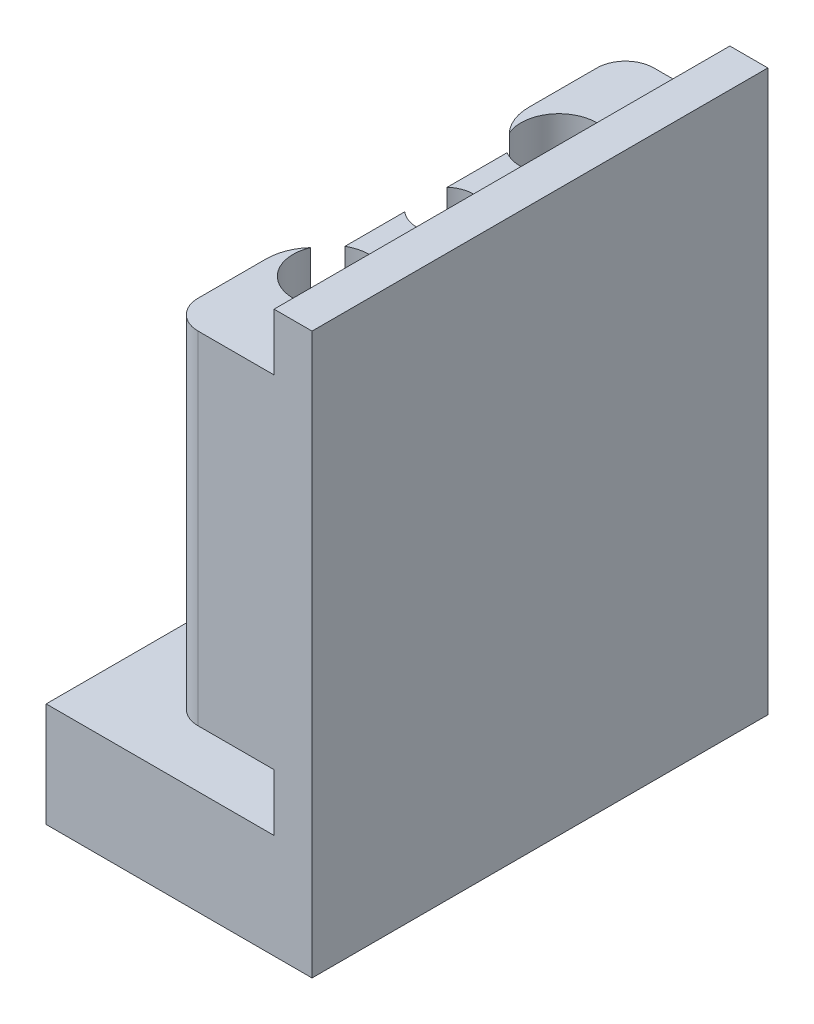
from build123d import *

# Parameters (mm, degrees)
SKETCH1_W           = 12
SKETCH1_H           = 24
BOSS_EXTRUDE1_DEPTH = 5.5
SKETCH2_W           = 2
SKETCH2_H           = 24
BOSS_EXTRUDE2_DEPTH = 29.5
BOSS_EXTRUDE4_START = 3
SKETCH4_W           = 5.5
SKETCH4_H           = 24
BOSS_EXTRUDE4_DEPTH = 18
SKETCH5_W           = 9.25
SKETCH5_H           = 18
CUT_EXTRUDE1_DEPTH  = 1.5
FILLET1_R           = 2.5
SKETCH6_R           = 2
SKETCH6_R_2         = 1.5
CUT_EXTRUDE2_DEPTH  = 31.170349683
FILLET2_R           = 1.5


with BuildPart() as part:
    # Sketch1 → Boss-Extrude1 (new body)
    with BuildSketch(Plane(origin=(0, 0, 0), x_dir=(1, 0, 0), z_dir=(0, 1, 0))):
        Rectangle(SKETCH1_W, SKETCH1_H)
    extrude(amount=BOSS_EXTRUDE1_DEPTH)

    # Sketch2 → Boss-Extrude2 (add)
    with BuildSketch(Plane(origin=(0, 0, 0), x_dir=(1, 0, 0), z_dir=(0, 1, 0))):
        with Locations((7, 0)):
            Rectangle(SKETCH2_W, SKETCH2_H)
    extrude(amount=BOSS_EXTRUDE2_DEPTH)

    # Sketch4 → Boss-Extrude4 (add)
    with BuildSketch(Plane(origin=(0, 5.5, 0), x_dir=(1, 0, 0), z_dir=(0, 1, 0)).offset(BOSS_EXTRUDE4_START)):
        with Locations((3.25, 0)):
            Rectangle(SKETCH4_W, SKETCH4_H)
    extrude(amount=BOSS_EXTRUDE4_DEPTH)

    # Sketch5 → Cut-Extrude1 (cut)
    with BuildSketch(Plane.ZY.offset(-0.5)):
        with Locations((0, 17.5)):
            Rectangle(SKETCH5_W, SKETCH5_H)
    extrude(amount=-CUT_EXTRUDE1_DEPTH, mode=Mode.SUBTRACT)

    # Fillet1
    # the kernel refuses this fillet: 2.5 mm, written as the material it takes off along each edge
    with BuildSketch(Plane(origin=(0.5, 32.228219619, 4.625), x_dir=(0, 0, 1), z_dir=(0, -1, 0)), Plane(origin=(0.5, 8.5, -4.625), x_dir=(0, 0, -1), z_dir=(0, 1, 0))) as fillet1_piece_1:
        with BuildLine():
            CenterArc((2.291287847, -2.5), FILLET1_R, 90, 66.421821522)
            Line((0, -1.5), (0, 0))
            Line((0, 0), (2.291287847, 0))
        make_face()
    extrude(amount=23.728219619, mode=Mode.SUBTRACT)

    # Sketch6 → Cut-Extrude2 (cut, through all)
    with BuildSketch(Plane(origin=(0, 26.5, 0), x_dir=(1, 0, 0), z_dir=(0, 1, 0))):
        with Locations(Location((3, -6, 0), (0, 0, 270))):
            Circle(SKETCH6_R)
        with Locations(Location((3, 6, 0), (0, 0, 90))):
            Circle(SKETCH6_R)
        with Locations(Location((3, 0, 0), (0, 0, 270))):
            Circle(SKETCH6_R_2)
    extrude(amount=-CUT_EXTRUDE2_DEPTH, mode=Mode.SUBTRACT)

    # Fillet2
    fillet2_edges = [part.edges().sort_by_distance(p)[0] for p in [
        (0.5, 17.5, -12),
        (0.5, 17.5, 12),
    ]]
    fillet(fillet2_edges, radius=FILLET2_R)


solid = part.part
